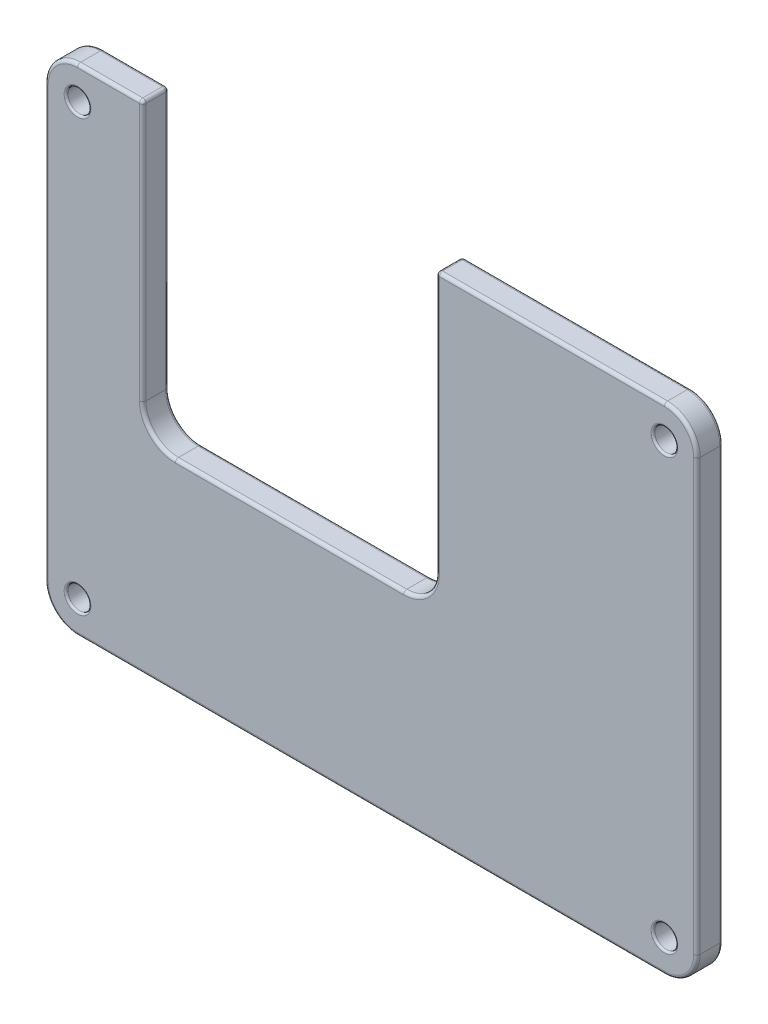
from build123d import *

# Parameters (mm, degrees)
SKETCH2_R           = 1.75
BOSS_EXTRUDE1_DEPTH = 4
FILLET1_R           = 0.5
FILLET2_R           = 0.5
FILLET3_R           = 0.3


with BuildPart() as part:
    # Sketch2 → Boss-Extrude1 (new body)
    with BuildSketch(Plane.XY):
        with BuildLine():
            Line((-260, -1421), (-270, -1421))
            ThreePointArc((-270, -1421), (-273.535533906, -1422.464466094), (-275, -1426))
            Line((-275, -1426), (-275, -1492))
            ThreePointArc((-275, -1492), (-273.535533906, -1495.535533906), (-270, -1497))
            Line((-270, -1497), (-180, -1497))
            ThreePointArc((-180, -1497), (-176.464466094, -1495.535533906), (-175, -1492))
            Line((-175, -1492), (-175, -1426))
            ThreePointArc((-175, -1426), (-176.464466094, -1422.464466094), (-180, -1421))
            Line((-180, -1421), (-215, -1421))
            Line((-215, -1421), (-215, -1461))
            ThreePointArc((-215, -1461), (-216.464466094, -1464.535533906), (-220, -1466))
            Line((-220, -1466), (-255, -1466))
            ThreePointArc((-255, -1466), (-258.535533906, -1464.535533906), (-260, -1461))
            Line((-260, -1461), (-260, -1421))
        make_face()
        with Locations((-180, -1492)):
            Circle(SKETCH2_R, mode=Mode.SUBTRACT)
        with Locations((-270, -1492)):
            Circle(SKETCH2_R, mode=Mode.SUBTRACT)
        with Locations((-270, -1426)):
            Circle(SKETCH2_R, mode=Mode.SUBTRACT)
        with Locations((-180, -1426)):
            Circle(SKETCH2_R, mode=Mode.SUBTRACT)
    extrude(amount=BOSS_EXTRUDE1_DEPTH)

    # Fillet1
    fillet1_edges = [part.edges().sort_by_distance(p)[0] for p in [
        (-175, -1459, 0),
        (-176.464466094, -1495.535533906, 0),
        (-225, -1497, 0),
        (-273.535533906, -1495.535533906, 0),
        (-275, -1459, 0),
        (-273.535533906, -1422.464466094, 0),
        (-265, -1421, 0),
        (-197.5, -1421, 0),
        (-176.464466094, -1422.464466094, 0),
        (-215, -1421, 2),
        (-265, -1421, 4),
        (-273.535533906, -1422.464466094, 4),
        (-275, -1459, 4),
        (-273.535533906, -1495.535533906, 4),
        (-225, -1497, 4),
        (-176.464466094, -1422.464466094, 4),
        (-176.464466094, -1495.535533906, 4),
        (-175, -1459, 4),
        (-197.5, -1421, 4),
    ]]
    fillet(fillet1_edges, radius=FILLET1_R)

    # Fillet2
    # the kernel refuses this fillet: 0.5 mm, written as the material it takes off along each edge
    with BuildSketch(Plane(origin=(-214.5, -1421.5, 0.5), x_dir=(-1, 0, 0), z_dir=(0, 0, -1))) as fillet2_piece_1_section:
        Polygon((0, 0), (FILLET2_R, 0), (FILLET2_R, FILLET2_R), (0, FILLET2_R), align=None)
    fillet2_piece_1 = extrude(amount=FILLET2_R, mode=Mode.PRIVATE)
    fillet2_piece_1 = fillet2_piece_1 - Plane(origin=(-214.5, -1421.5, 0.5), x_dir=(0.7071067811865475, -0.7071067811865475, 0), z_dir=(0, 0, -1)) * Sphere(FILLET2_R, mode=Mode.PRIVATE)
    add(fillet2_piece_1, mode=Mode.SUBTRACT)
    with BuildSketch(Plane(origin=(-214.5, -1421.5, 3.5), x_dir=(-1, 0, 0), z_dir=(0, 0, 1))) as fillet2_piece_2_section:
        Polygon((0, 0), (FILLET2_R, 0), (FILLET2_R, -FILLET2_R), (0, -FILLET2_R), align=None)
    fillet2_piece_2 = extrude(amount=FILLET2_R, mode=Mode.PRIVATE)
    fillet2_piece_2 = fillet2_piece_2 - Plane(origin=(-214.5, -1421.5, 3.5), x_dir=(0.7071067811865475, -0.7071067811865475, 0), z_dir=(0, 0, 1)) * Sphere(FILLET2_R, mode=Mode.PRIVATE)
    add(fillet2_piece_2, mode=Mode.SUBTRACT)
    with BuildSketch(Plane(origin=(-260, -1461, 0), x_dir=(0, 0, 1), z_dir=(0, 1, 0)), Plane(origin=(-215, -1421.5, 4), x_dir=(1, 0, 0), z_dir=(0, -1, 0))) as fillet2_piece_3:
        with BuildLine():
            CenterArc((FILLET2_R, -FILLET2_R), FILLET2_R, 90, 90)
            Line((0, -FILLET2_R), (0, 0))
            Line((0, 0), (FILLET2_R, 0))
        make_face()
    extrude(amount=39.5, mode=Mode.SUBTRACT)
    with BuildSketch(Plane(origin=(-220, -1461, 4), x_dir=(1, 0, 0), z_dir=(0, 1, 0))) as fillet2_piece_4:
        with BuildLine():
            CenterArc((5 + FILLET2_R, FILLET2_R), FILLET2_R, 180, 90)
            Line((5, FILLET2_R), (5, 0))
            Line((5, 0), (5 + FILLET2_R, 0))
        make_face()
    revolve(axis=Axis((-220, -1461, 4), (0, 0, -1)), revolution_arc=90, mode=Mode.SUBTRACT)
    with BuildSketch(Plane(origin=(-255, -1461, 0), x_dir=(0, -1, 0), z_dir=(1, 0, 0))) as fillet2_piece_5:
        with BuildLine():
            CenterArc((5 + FILLET2_R, -FILLET2_R), FILLET2_R, 90, 90)
            Line((5, -FILLET2_R), (5, 0))
            Line((5, 0), (5 + FILLET2_R, 0))
        make_face()
    revolve(axis=Axis((-255, -1461, 0), (0, 0, -1)), revolution_arc=90, mode=Mode.SUBTRACT)
    with BuildSketch(Plane(origin=(-220, -1466, 0), x_dir=(0, -1, 0), z_dir=(-1, 0, 0))) as fillet2_piece_6:
        with BuildLine():
            CenterArc((FILLET2_R, FILLET2_R), FILLET2_R, 180, 90)
            Line((0, FILLET2_R), (0, 0))
            Line((0, 0), (FILLET2_R, 0))
        make_face()
    extrude(amount=35, mode=Mode.SUBTRACT)
    with BuildSketch(Plane(origin=(-220, -1461, 0), x_dir=(1, 0, 0), z_dir=(0, 1, 0))) as fillet2_piece_7:
        with BuildLine():
            CenterArc((5 + FILLET2_R, -FILLET2_R), FILLET2_R, 90, 90)
            Line((5, -FILLET2_R), (5, 0))
            Line((5, 0), (5 + FILLET2_R, 0))
        make_face()
    revolve(axis=Axis((-220, -1461, 0), (0, 0, -1)), revolution_arc=90, mode=Mode.SUBTRACT)
    with BuildSketch(Plane(origin=(-220, -1466, 4), x_dir=(0, -1, 0), z_dir=(-1, 0, 0))) as fillet2_piece_8:
        with BuildLine():
            CenterArc((FILLET2_R, -FILLET2_R), FILLET2_R, 90, 90)
            Line((0, -FILLET2_R), (0, 0))
            Line((0, 0), (FILLET2_R, 0))
        make_face()
    extrude(amount=35, mode=Mode.SUBTRACT)
    with BuildSketch(Plane(origin=(-255, -1461, 4), x_dir=(0, -1, 0), z_dir=(1, 0, 0))) as fillet2_piece_9:
        with BuildLine():
            CenterArc((5 + FILLET2_R, FILLET2_R), FILLET2_R, 180, 90)
            Line((5, FILLET2_R), (5, 0))
            Line((5, 0), (5 + FILLET2_R, 0))
        make_face()
    revolve(axis=Axis((-255, -1461, 4), (0, 0, -1)), revolution_arc=90, mode=Mode.SUBTRACT)
    with BuildSketch(Plane(origin=(-260, -1461, 4), x_dir=(0, 0, -1), z_dir=(0, 1, 0)), Plane(origin=(-215, -1421.5, 0), x_dir=(1, 0, 0), z_dir=(0, -1, 0))) as fillet2_piece_10:
        with BuildLine():
            CenterArc((FILLET2_R, FILLET2_R), FILLET2_R, 180, 90)
            Line((0, FILLET2_R), (0, 0))
            Line((0, 0), (FILLET2_R, 0))
        make_face()
    extrude(amount=39.5, mode=Mode.SUBTRACT)
    with BuildSketch(Plane(origin=(-260, -1421, 0.5), x_dir=(0, -1, 0), z_dir=(0, 0, 1))) as fillet2_piece_11:
        with BuildLine():
            CenterArc((FILLET2_R, -FILLET2_R), FILLET2_R, 90, 90)
            Line((0, -FILLET2_R), (0, 0))
            Line((0, 0), (FILLET2_R, 0))
        make_face()
    extrude(amount=3, mode=Mode.SUBTRACT)
    with BuildSketch(Plane(origin=(-260, -1421.5, 0.5), x_dir=(0, 1, 0), z_dir=(0, 0, 1))) as fillet2_piece_12:
        with BuildLine():
            CenterArc((0.5 - FILLET2_R, FILLET2_R), FILLET2_R, 270, 90)
            Line((0.5, FILLET2_R), (0.5, 0))
            Line((0.5, 0), (0.5 - FILLET2_R, 0))
        make_face()
    revolve(axis=Axis((-260, -1421.5, 0.5), (-1, 0, 0)), revolution_arc=90, mode=Mode.SUBTRACT)
    with BuildSketch(Plane(origin=(-260, -1421.5, 3.5), x_dir=(0, 1, 0), z_dir=(0, 0, -1))) as fillet2_piece_13:
        with BuildLine():
            CenterArc((0.5 - FILLET2_R, -FILLET2_R), FILLET2_R, 0, 90)
            Line((0.5, -FILLET2_R), (0.5, 0))
            Line((0.5, 0), (0.5 - FILLET2_R, 0))
        make_face()
    revolve(axis=Axis((-260, -1421.5, 3.5), (1, 0, 0)), revolution_arc=90, mode=Mode.SUBTRACT)

    # Fillet3
    fillet3_edges = [part.edges().sort_by_distance(p)[0] for p in [
        (-181.75, -1492, 0),
        (-181.75, -1492, 4),
        (-271.75, -1492, 0),
        (-271.75, -1492, 4),
        (-271.75, -1426, 0),
        (-271.75, -1426, 4),
        (-181.75, -1426, 0),
        (-181.75, -1426, 4),
    ]]
    fillet(fillet3_edges, radius=FILLET3_R)


solid = part.part
